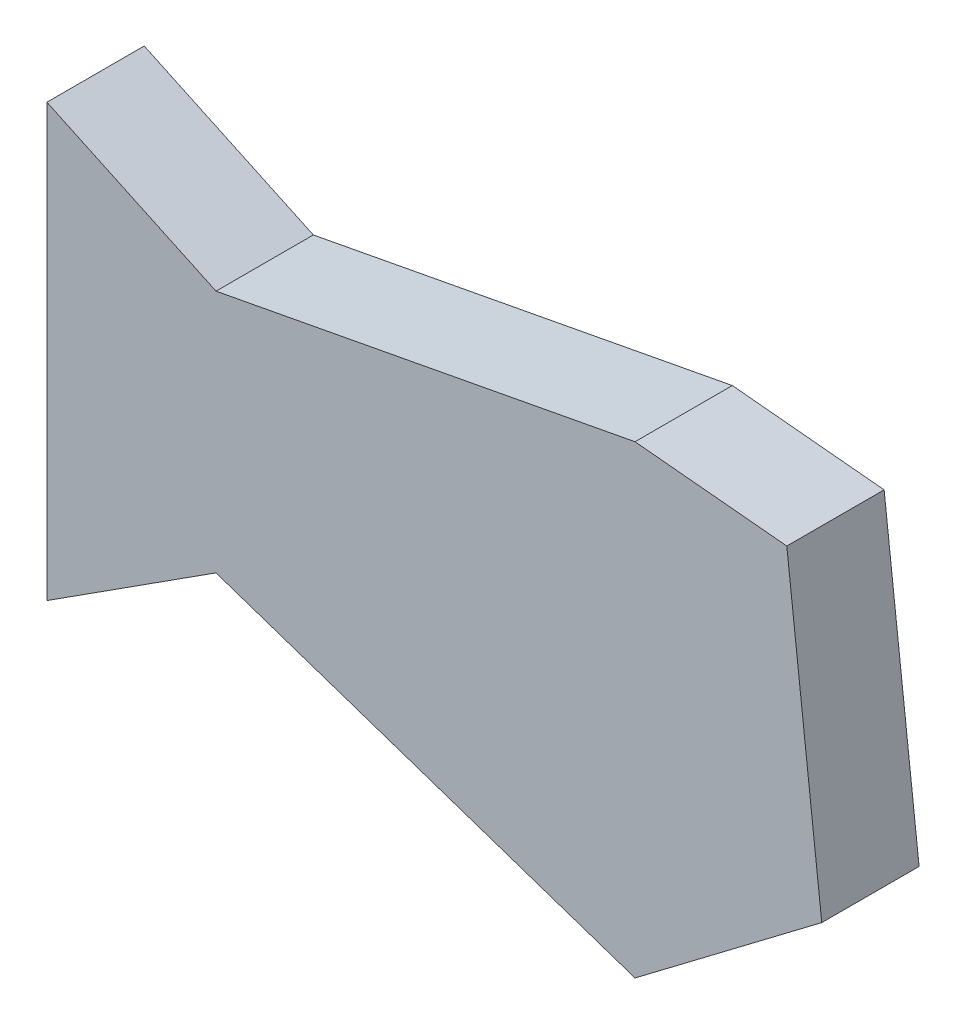
from build123d import *

# Parameters (mm, degrees)
EXTRUDE_1_DEPTH = 10


with BuildPart() as part:
    # Эскиз1 → Бобышка-Вытянуть1 (new body)
    with BuildSketch(Plane.XY):
        Polygon((-32.676307008, 20.876529477), (-32.676307008, -23.469887176), (-15.300810424, -12.31844907), (27.74892738, -26.841252185), (46.939774352, -12.31844907), (43.346792682, 19.395277105), (27.74892738, 20.876529477), (-15.300810424, 12.750843026), align=None)
    extrude(amount=EXTRUDE_1_DEPTH)


solid = part.part
